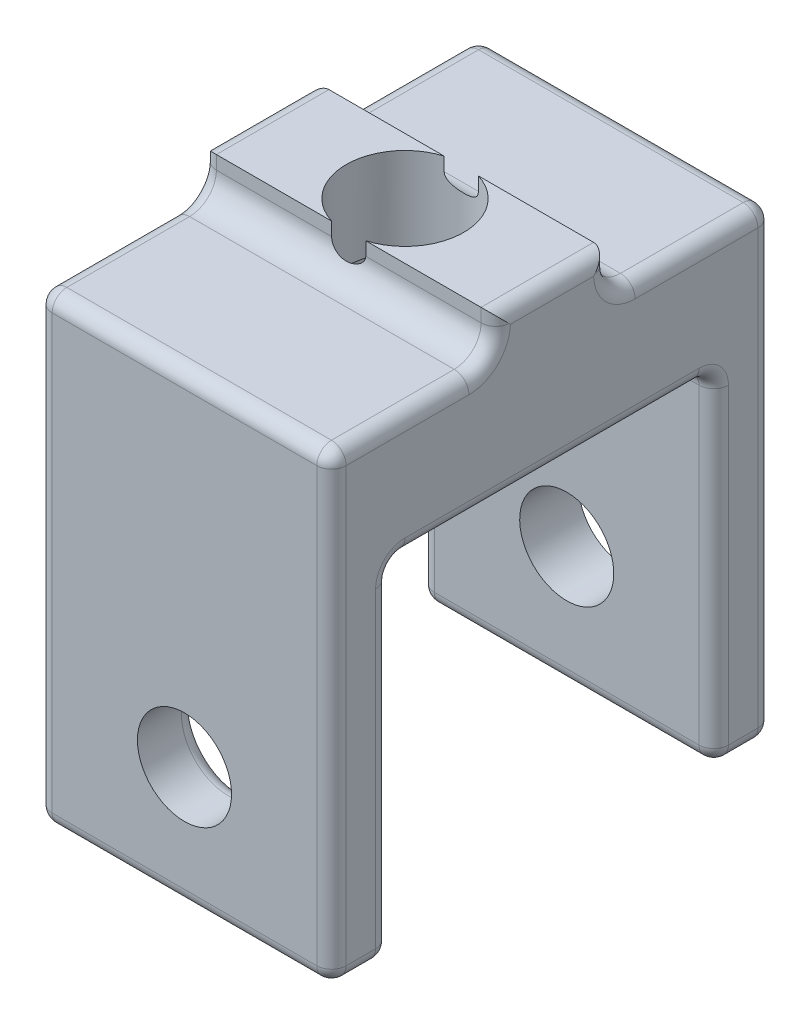
from build123d import *

# Parameters (mm, degrees)
SKETCH1_W           = 30
SKETCH1_H           = 8.25963266
BOSS_EXTRUDE1_DEPTH = 20
SKETCH2_R           = 4
CUT_EXTRUDE1_DEPTH  = 20
SKETCH2_3_R         = 8.5
SKETCH2_3_R_2       = 4
CUT_EXTRUDE2_DEPTH  = 5
SKETCH3_W           = 20
SKETCH3_H           = 23.2
SKETCH3_R           = 5
SKETCH3_R_2         = 3.2
BOSS_EXTRUDE2_DEPTH = 4
BOSS_EXTRUDE3_START = -26
SKETCH3_3_W         = 20
SKETCH3_3_H         = 23.2
SKETCH3_3_R         = 5
SKETCH3_3_R_2       = 3.2
BOSS_EXTRUDE3_DEPTH = 4
FILLET1_R           = 1


with BuildPart() as part:
    # Sketch1 → Boss-Extrude1 (new body)
    with BuildSketch(Plane(origin=(0, 0, 0), x_dir=(0, 0, -1), z_dir=(1, 0, 0))):
        with Locations((-10.691950058, -23.429816412)):
            Rectangle(SKETCH1_W, SKETCH1_H)
        with BuildLine():
            Line((-16.344503942, -19.300000082), (-5.039396175, -19.300000082))
            ThreePointArc((-5.039396175, -19.300000082), (-6.329725463, -18.765528762), (-6.864196994, -17.475199263))
            Line((-6.864196994, -17.475199263), (-6.864196994, -16.559632742))
            Line((-6.864196994, -16.559632742), (-14.519703122, -16.559632742))
            Line((-14.519703122, -16.559632742), (-14.519703122, -17.475199263))
            ThreePointArc((-14.519703122, -17.475199263), (-15.054174908, -18.765528296), (-16.344503942, -19.300000082))
        make_face()
    extrude(amount=BOSS_EXTRUDE1_DEPTH)

    # Sketch2 → Cut-Extrude1 (cut)
    with BuildSketch(Plane.XZ.offset(27.559632742)):
        with Locations(Location((10, 10.691950058, 0), (0, 0, 270))):
            Circle(SKETCH2_R)
    extrude(amount=-CUT_EXTRUDE1_DEPTH, mode=Mode.SUBTRACT)

    # Sketch2<3> → Cut-Extrude2 (cut)
    with BuildSketch(Plane.XZ.offset(27.559632742)):
        with Locations(Location((10, 10.691950058, 0), (0, 0, 270))):
            Circle(SKETCH2_3_R)
        with Locations(Location((10, 10.691950058, 0), (0, 0, 270))):
            Circle(SKETCH2_3_R_2, mode=Mode.SUBTRACT)
    extrude(amount=-CUT_EXTRUDE2_DEPTH, mode=Mode.SUBTRACT)

    # Sketch3 → Boss-Extrude2 (add)
    # profile 1 of 2: a face of its own
    with BuildSketch(Plane(origin=(0, 0, -4.308049942), x_dir=(-1, 0, 0), z_dir=(0, 0, -1))):
        with Locations((-10, -39.159632742)):
            Rectangle(SKETCH3_W, SKETCH3_H)
        with Locations((-10, -42.559632742)):
            Circle(SKETCH3_R, mode=Mode.SUBTRACT)
    # profile 2 of 2: a face of its own
    with BuildSketch(Plane(origin=(0, 0, -4.308049942), x_dir=(-1, 0, 0), z_dir=(0, 0, -1))):
        with Locations((-10, -42.559632742)):
            Circle(SKETCH3_R)
        with Locations(Location((-10, -42.559632742, 0), (0, 0, 90))):
            Circle(SKETCH3_R_2, mode=Mode.SUBTRACT)
    extrude(amount=-BOSS_EXTRUDE2_DEPTH)

    # Sketch3<3> → Boss-Extrude3 (add)
    # profile 1 of 2: a face of its own
    with BuildSketch(Plane(origin=(0, 0, -4.308049942), x_dir=(-1, 0, 0), z_dir=(0, 0, -1)).offset(BOSS_EXTRUDE3_START)):
        with Locations((-10, -39.159632742)):
            Rectangle(SKETCH3_3_W, SKETCH3_3_H)
        with Locations((-10, -42.559632742)):
            Circle(SKETCH3_3_R, mode=Mode.SUBTRACT)
    # profile 2 of 2: a face of its own
    with BuildSketch(Plane(origin=(0, 0, -4.308049942), x_dir=(-1, 0, 0), z_dir=(0, 0, -1)).offset(BOSS_EXTRUDE3_START)):
        with Locations((-10, -42.559632742)):
            Circle(SKETCH3_3_R)
        with Locations(Location((-10, -42.559632742, 0), (0, 0, 90))):
            Circle(SKETCH3_3_R_2, mode=Mode.SUBTRACT)
    extrude(amount=-BOSS_EXTRUDE3_DEPTH)

    # Fillet1
    # the kernel refuses this fillet: 1 mm, written as the material it adds along each edge
    with BuildSketch(Plane(origin=(20, -27.559632742, -0.308049942), x_dir=(0, 0, 1), z_dir=(-1, 0, 0)), Plane(origin=(20, -27.559632742, 21.691950058), x_dir=(0, -1, 0), z_dir=(-1, 0, 0))) as fillet1_piece_1:
        with BuildLine():
            CenterArc((FILLET1_R, -FILLET1_R), FILLET1_R, 90, 90)
            Line((0, -FILLET1_R), (0, 0))
            Line((0, 0), (FILLET1_R, 0))
        make_face()
    extrude(amount=20)
    # the kernel refuses this fillet: 1 mm, written as the material it takes off along each edge
    with BuildSketch(Plane(origin=(19, -20.300000082, -3.308049942), x_dir=(0, 0, -1), z_dir=(0, 1, 0))) as fillet1_2_piece_1_section:
        Polygon((0, 0), (FILLET1_R, 0), (FILLET1_R, -FILLET1_R), (0, -FILLET1_R), align=None)
    fillet1_2_piece_1 = extrude(amount=FILLET1_R, mode=Mode.PRIVATE)
    fillet1_2_piece_1 = fillet1_2_piece_1 - Plane(origin=(19, -20.300000082, -3.308049942), x_dir=(-0.7071067811865475, -2.5852550975749018e-14, 0.7071067811865475), z_dir=(0, 1, 0)) * Sphere(FILLET1_R, mode=Mode.PRIVATE)
    add(fillet1_2_piece_1, mode=Mode.SUBTRACT)
    with BuildSketch(Plane(origin=(19, -49.759632742, -3.308049942), x_dir=(0, 0, -1), z_dir=(0, -1, 0))) as fillet1_2_piece_2_section:
        Polygon((0, 0), (FILLET1_R, 0), (FILLET1_R, FILLET1_R), (0, FILLET1_R), align=None)
    fillet1_2_piece_2 = extrude(amount=FILLET1_R, mode=Mode.PRIVATE)
    fillet1_2_piece_2 = fillet1_2_piece_2 - Plane(origin=(19, -49.759632742, -3.308049942), x_dir=(-0.7071067811865475, -2.5852550975749018e-14, 0.7071067811865475), z_dir=(0, -1, 0)) * Sphere(FILLET1_R, mode=Mode.PRIVATE)
    add(fillet1_2_piece_2, mode=Mode.SUBTRACT)
    with BuildSketch(Plane(origin=(19, -20.300000082, 24.691950058), x_dir=(1, 0, 0), z_dir=(0, 1, 0))) as fillet1_2_piece_3_section:
        Polygon((0, 0), (FILLET1_R, 0), (FILLET1_R, -FILLET1_R), (0, -FILLET1_R), align=None)
    fillet1_2_piece_3 = extrude(amount=FILLET1_R, mode=Mode.PRIVATE)
    fillet1_2_piece_3 = fillet1_2_piece_3 - Plane(origin=(19, -20.300000082, 24.691950058), x_dir=(-0.7071067811865475, 2.5852550975749008e-14, -0.7071067811865475), z_dir=(0, 1, 0)) * Sphere(FILLET1_R, mode=Mode.PRIVATE)
    add(fillet1_2_piece_3, mode=Mode.SUBTRACT)
    with BuildSketch(Plane(origin=(19, -49.759632742, 24.691950058), x_dir=(0, 0, 1), z_dir=(1, 0, 0))) as fillet1_2_piece_4_section:
        Polygon((0, 0), (FILLET1_R, 0), (FILLET1_R, FILLET1_R), (0, FILLET1_R), align=None)
    fillet1_2_piece_4 = extrude(amount=FILLET1_R, mode=Mode.PRIVATE)
    fillet1_2_piece_4 = fillet1_2_piece_4 - Plane(origin=(19, -49.759632742, 24.691950058), x_dir=(0, 0.7071067811865733, -0.7071067811865216), z_dir=(1, 0, 0)) * Sphere(FILLET1_R, mode=Mode.PRIVATE)
    add(fillet1_2_piece_4, mode=Mode.SUBTRACT)
    with BuildSketch(Plane(origin=(1, -20.300000082, 24.691950058), x_dir=(-1, 0, 0), z_dir=(0, 1, 0))) as fillet1_2_piece_5_section:
        Polygon((0, 0), (FILLET1_R, 0), (FILLET1_R, FILLET1_R), (0, FILLET1_R), align=None)
    fillet1_2_piece_5 = extrude(amount=FILLET1_R, mode=Mode.PRIVATE)
    fillet1_2_piece_5 = fillet1_2_piece_5 - Plane(origin=(1, -20.300000082, 24.691950058), x_dir=(0.7071067811865475, 2.5852550975749008e-14, -0.7071067811865475), z_dir=(0, 1, 0)) * Sphere(FILLET1_R, mode=Mode.PRIVATE)
    add(fillet1_2_piece_5, mode=Mode.SUBTRACT)
    with BuildSketch(Plane(origin=(1, -49.759632742, 24.691950058), x_dir=(0, 0, 1), z_dir=(-1, 0, 0))) as fillet1_2_piece_6_section:
        Polygon((0, 0), (FILLET1_R, 0), (FILLET1_R, -FILLET1_R), (0, -FILLET1_R), align=None)
    fillet1_2_piece_6 = extrude(amount=FILLET1_R, mode=Mode.PRIVATE)
    fillet1_2_piece_6 = fillet1_2_piece_6 - Plane(origin=(1, -49.759632742, 24.691950058), x_dir=(0, 0.7071067811865733, -0.7071067811865216), z_dir=(-1, 0, 0)) * Sphere(FILLET1_R, mode=Mode.PRIVATE)
    add(fillet1_2_piece_6, mode=Mode.SUBTRACT)
    with BuildSketch(Plane(origin=(1, -49.759632742, -3.308049942), x_dir=(0, 0, -1), z_dir=(-1, 0, 0))) as fillet1_2_piece_7_section:
        Polygon((0, 0), (FILLET1_R, 0), (FILLET1_R, FILLET1_R), (0, FILLET1_R), align=None)
    fillet1_2_piece_7 = extrude(amount=FILLET1_R, mode=Mode.PRIVATE)
    fillet1_2_piece_7 = fillet1_2_piece_7 - Plane(origin=(1, -49.759632742, -3.308049942), x_dir=(0, 0.7071067811865216, 0.7071067811865733), z_dir=(-1, 0, 0)) * Sphere(FILLET1_R, mode=Mode.PRIVATE)
    add(fillet1_2_piece_7, mode=Mode.SUBTRACT)
    with BuildSketch(Plane(origin=(1, -20.300000082, -3.308049942), x_dir=(0, 0, -1), z_dir=(-1, 0, 0))) as fillet1_2_piece_8_section:
        Polygon((0, 0), (FILLET1_R, 0), (FILLET1_R, -FILLET1_R), (0, -FILLET1_R), align=None)
    fillet1_2_piece_8 = extrude(amount=FILLET1_R, mode=Mode.PRIVATE)
    fillet1_2_piece_8 = fillet1_2_piece_8 - Plane(origin=(1, -20.300000082, -3.308049942), x_dir=(0, -0.7071067811865605, 0.7071067811865346), z_dir=(-1, 0, 0)) * Sphere(FILLET1_R, mode=Mode.PRIVATE)
    add(fillet1_2_piece_8, mode=Mode.SUBTRACT)
    with BuildSketch(Plane(origin=(-2.5, -50.759632742, -0.308049942), x_dir=(0, 0, -1), z_dir=(1, 0, 0)), Plane(origin=(-2.5, -50.759632742, 21.691950058), x_dir=(0, 1, 0), z_dir=(1, 0, 0))) as fillet1_2_piece_9:
        with BuildLine():
            CenterArc((FILLET1_R, FILLET1_R), FILLET1_R, 180, 90)
            Line((0, FILLET1_R), (0, 0))
            Line((0, 0), (FILLET1_R, 0))
        make_face()
    extrude(amount=25, mode=Mode.SUBTRACT)
    with BuildSketch(Plane(origin=(20, -19.300000082, 5.039396175), x_dir=(0, -1, 0), z_dir=(0, 0, -1)), Plane(origin=(0, -19.300000082, 24.691950058), x_dir=(1, 0, 0), z_dir=(0, 0, -1))) as fillet1_2_piece_10:
        with BuildLine():
            CenterArc((FILLET1_R, FILLET1_R), FILLET1_R, 180, 90)
            Line((0, FILLET1_R), (0, 0))
            Line((0, 0), (FILLET1_R, 0))
        make_face()
    extrude(amount=8.347446117, mode=Mode.SUBTRACT)
    with BuildSketch(Plane(origin=(20, -49.759632742, -4.308049942), x_dir=(0, 0, 1), z_dir=(0, 1, 0)), Plane(origin=(20, -20.300000082, 25.691950058), x_dir=(0, 0, -1), z_dir=(0, -1, 0)), Plane(origin=(0, -49.759632742, 25.691950058), x_dir=(0, 0, -1), z_dir=(0, 1, 0)), Plane(origin=(0, -20.300000082, -4.308049942), x_dir=(0, 0, 1), z_dir=(0, -1, 0))) as fillet1_2_piece_11:
        with BuildLine():
            CenterArc((FILLET1_R, -FILLET1_R), FILLET1_R, 90, 90)
            Line((0, -FILLET1_R), (0, 0))
            Line((0, 0), (FILLET1_R, 0))
        make_face()
    extrude(amount=29.45963266, mode=Mode.SUBTRACT)
    with BuildSketch(Plane(origin=(20, -50.759632742, -3.308049942), x_dir=(0, 1, 0), z_dir=(0, 0, 1)), Plane(origin=(20, -50.759632742, 19.191950058), x_dir=(0, 1, 0), z_dir=(0, 0, 1))) as fillet1_2_piece_12:
        with BuildLine():
            CenterArc((FILLET1_R, FILLET1_R), FILLET1_R, 180, 90)
            Line((0, FILLET1_R), (0, 0))
            Line((0, 0), (FILLET1_R, 0))
        make_face()
    extrude(amount=5.5, mode=Mode.SUBTRACT)
    with BuildSketch(Plane(origin=(20, -19.300000082, 24.691950058), x_dir=(-1, 0, 0), z_dir=(0, 0, -1)), Plane(origin=(0, -19.300000082, 5.039396175), x_dir=(0, -1, 0), z_dir=(0, 0, -1))) as fillet1_2_piece_13:
        with BuildLine():
            CenterArc((FILLET1_R, -FILLET1_R), FILLET1_R, 90, 90)
            Line((0, -FILLET1_R), (0, 0))
            Line((0, 0), (FILLET1_R, 0))
        make_face()
    extrude(amount=8.347446117, mode=Mode.SUBTRACT)
    with BuildSketch(Plane(origin=(20, -17.475199263, 16.344503942), x_dir=(0, 0, -1), z_dir=(0, 1, 0))) as fillet1_2_piece_14:
        with BuildLine():
            CenterArc((1.824800819 + FILLET1_R, FILLET1_R), FILLET1_R, 180, 90)
            Line((1.824800819 + FILLET1_R, 0), (1.824800819, 0))
            Line((1.824800819, 0), (1.824800819, FILLET1_R))
        make_face()
    revolve(axis=Axis((20, -17.475199263, 16.344503942), (-1, 0, 0)), revolution_arc=90, mode=Mode.SUBTRACT)
    with BuildSketch(Plane(origin=(20, -16.559632742, 4.364196994), x_dir=(0, -1, 0), z_dir=(0, 0, 1))) as fillet1_2_piece_15:
        with BuildLine():
            CenterArc((FILLET1_R, -FILLET1_R), FILLET1_R, 90, 90)
            Line((0, -FILLET1_R), (0, 0))
            Line((0, 0), (FILLET1_R, 0))
        make_face()
    extrude(amount=12.655506128, mode=Mode.SUBTRACT)
    with BuildSketch(Plane(origin=(20, -17.475200493, 5.039397405), x_dir=(0, -0.9999999999997728, -6.741053946640154e-07), z_dir=(0, 6.741053946640154e-07, -0.9999999999997728))) as fillet1_2_piece_16:
        with BuildLine():
            CenterArc((1.824799589 + FILLET1_R, FILLET1_R), FILLET1_R, 180, 90)
            Line((1.824799589, FILLET1_R), (1.824799589, 0))
            Line((1.824799589, 0), (1.824799589 + FILLET1_R, 0))
        make_face()
    revolve(axis=Axis((20, -17.475200493, 5.039397405), (-1, 0, 0)), revolution_arc=90.000077247, mode=Mode.SUBTRACT)
    with BuildSketch(Plane(origin=(0, -16.559632742, 4.364196994), x_dir=(0, -1, 0), z_dir=(0, 0, 1))) as fillet1_2_piece_17:
        with BuildLine():
            CenterArc((FILLET1_R, FILLET1_R), FILLET1_R, 180, 90)
            Line((0, FILLET1_R), (0, 0))
            Line((0, 0), (FILLET1_R, 0))
        make_face()
    extrude(amount=12.655506128, mode=Mode.SUBTRACT)
    with BuildSketch(Plane(origin=(0, -17.475199263, 16.344503942), x_dir=(0, 0, -1), z_dir=(0, 1, 0))) as fillet1_2_piece_18:
        with BuildLine():
            CenterArc((1.824800819 + FILLET1_R, -FILLET1_R), FILLET1_R, 90, 90)
            Line((1.824800819, -FILLET1_R), (1.824800819, 0))
            Line((1.824800819, 0), (1.824800819 + FILLET1_R, 0))
        make_face()
    revolve(axis=Axis((0, -17.475199263, 16.344503942), (-1, 0, 0)), revolution_arc=90, mode=Mode.SUBTRACT)
    with BuildSketch(Plane(origin=(0, -50.759632742, -3.308049942), x_dir=(0, 1, 0), z_dir=(0, 0, 1)), Plane(origin=(0, -50.759632742, 19.191950058), x_dir=(0, 1, 0), z_dir=(0, 0, 1))) as fillet1_2_piece_19:
        with BuildLine():
            CenterArc((FILLET1_R, -FILLET1_R), FILLET1_R, 90, 90)
            Line((0, -FILLET1_R), (0, 0))
            Line((0, 0), (FILLET1_R, 0))
        make_face()
    extrude(amount=5.5, mode=Mode.SUBTRACT)
    with BuildSketch(Plane(origin=(0, -17.475200493, 5.039397405), x_dir=(0, -0.9999999999997728, -6.741053946640154e-07), z_dir=(0, 6.741053946640154e-07, -0.9999999999997728))) as fillet1_2_piece_20:
        with BuildLine():
            CenterArc((1.824799589 + FILLET1_R, -FILLET1_R), FILLET1_R, 90, 90)
            Line((1.824799589, -FILLET1_R), (1.824799589, 0))
            Line((1.824799589, 0), (1.824799589 + FILLET1_R, 0))
        make_face()
    revolve(axis=Axis((0, -17.475200493, 5.039397405), (-1, 0, 0)), revolution_arc=90.000077247, mode=Mode.SUBTRACT)
    with BuildSketch(Plane(origin=(1, -50.759632742, 25.691950058), x_dir=(0, 1.0, -2.3092638912203256e-12), z_dir=(1, 0, 0)), Plane(origin=(1, -19.300000082, 25.691950058), x_dir=(0, 0, -1), z_dir=(1, 0, 0))) as fillet1_2_piece_21:
        with BuildLine():
            CenterArc((FILLET1_R, -FILLET1_R), FILLET1_R, 90, 90)
            Line((0, -FILLET1_R), (0, 0))
            Line((0, 0), (FILLET1_R, 0))
        make_face()
    extrude(amount=18, mode=Mode.SUBTRACT)
    with BuildSketch(Plane(origin=(10, -42.559632742, 21.691950058), x_dir=(0, 1, 0), z_dir=(-1, 0, 0))) as fillet1_2_piece_22:
        with BuildLine():
            CenterArc((3.2 + FILLET1_R, -FILLET1_R), FILLET1_R, 90, 90)
            Line((3.2, -FILLET1_R), (3.2, 0))
            Line((3.2, 0), (3.2 + FILLET1_R, 0))
        make_face()
    revolve(axis=Axis((10, -42.559632742, 21.691950058), (0, 0, -1)), mode=Mode.SUBTRACT)
    with BuildSketch(Plane(origin=(1, -19.300000082, -4.308049942), x_dir=(0, 0, 1), z_dir=(1, 0, 0)), Plane(origin=(1, -50.759632742, -4.308049942), x_dir=(0, 1, 0), z_dir=(1, 0, 0))) as fillet1_2_piece_23:
        with BuildLine():
            CenterArc((FILLET1_R, FILLET1_R), FILLET1_R, 180, 90)
            Line((0, FILLET1_R), (0, 0))
            Line((0, 0), (FILLET1_R, 0))
        make_face()
    extrude(amount=18, mode=Mode.SUBTRACT)
    with BuildSketch(Plane(origin=(0, -17.475199263, 6.864196994), x_dir=(0, 0, 1), z_dir=(0, 1, 0)), Plane(origin=(0, -14.059632742, 14.519703122), x_dir=(0, 0, -1), z_dir=(0, -1, 0))) as fillet1_2_piece_24:
        with BuildLine():
            CenterArc((FILLET1_R, FILLET1_R), FILLET1_R, 180, 90)
            Line((0, FILLET1_R), (0, 0))
            Line((0, 0), (FILLET1_R, 0))
        make_face()
    extrude(amount=3.415566521, mode=Mode.SUBTRACT)
    with BuildSketch(Plane(origin=(20, -17.475199263, 6.864196994), x_dir=(0, 0, 1), z_dir=(0, 1, 0)), Plane(origin=(20, -14.059632742, 14.519703122), x_dir=(0, 0, -1), z_dir=(0, -1, 0))) as fillet1_2_piece_25:
        with BuildLine():
            CenterArc((FILLET1_R, -FILLET1_R), FILLET1_R, 90, 90)
            Line((0, -FILLET1_R), (0, 0))
            Line((0, 0), (FILLET1_R, 0))
        make_face()
    extrude(amount=3.415566521, mode=Mode.SUBTRACT)
    # the kernel refuses this fillet: 1 mm, written as the material it takes off along each edge
    with BuildSketch(Plane(origin=(1, -49.759632742, 22.691950058), x_dir=(0, 0, -1), z_dir=(-1, 0, 0))) as fillet1_3_piece_1_section:
        Polygon((0, 0), (FILLET1_R, 0), (FILLET1_R, FILLET1_R), (0, FILLET1_R), align=None)
    fillet1_3_piece_1 = extrude(amount=FILLET1_R, mode=Mode.PRIVATE)
    fillet1_3_piece_1 = fillet1_3_piece_1 - Plane(origin=(1, -49.759632742, 22.691950058), x_dir=(0, 0.7071067811865216, 0.7071067811865733), z_dir=(-1, 0, 0)) * Sphere(FILLET1_R, mode=Mode.PRIVATE)
    add(fillet1_3_piece_1, mode=Mode.SUBTRACT)
    with BuildSketch(Plane(origin=(19, -49.759632742, 22.691950058), x_dir=(0, 0, -1), z_dir=(1, 0, 0))) as fillet1_3_piece_2_section:
        Polygon((0, 0), (FILLET1_R, 0), (FILLET1_R, -FILLET1_R), (0, -FILLET1_R), align=None)
    fillet1_3_piece_2 = extrude(amount=FILLET1_R, mode=Mode.PRIVATE)
    fillet1_3_piece_2 = fillet1_3_piece_2 - Plane(origin=(19, -49.759632742, 22.691950058), x_dir=(0, 0.7071067811865216, 0.7071067811865733), z_dir=(1, 0, 0)) * Sphere(FILLET1_R, mode=Mode.PRIVATE)
    add(fillet1_3_piece_2, mode=Mode.SUBTRACT)
    with BuildSketch(Plane(origin=(1, -49.759632742, -1.308049942), x_dir=(0, 0, 1), z_dir=(-1, 0, 0))) as fillet1_3_piece_3_section:
        Polygon((0, 0), (FILLET1_R, 0), (FILLET1_R, -FILLET1_R), (0, -FILLET1_R), align=None)
    fillet1_3_piece_3 = extrude(amount=FILLET1_R, mode=Mode.PRIVATE)
    fillet1_3_piece_3 = fillet1_3_piece_3 - Plane(origin=(1, -49.759632742, -1.308049942), x_dir=(0, 0.7071067811865733, -0.7071067811865216), z_dir=(-1, 0, 0)) * Sphere(FILLET1_R, mode=Mode.PRIVATE)
    add(fillet1_3_piece_3, mode=Mode.SUBTRACT)
    with BuildSketch(Plane(origin=(19, -49.759632742, -1.308049942), x_dir=(0, 0, 1), z_dir=(1, 0, 0))) as fillet1_3_piece_4_section:
        Polygon((0, 0), (FILLET1_R, 0), (FILLET1_R, FILLET1_R), (0, FILLET1_R), align=None)
    fillet1_3_piece_4 = extrude(amount=FILLET1_R, mode=Mode.PRIVATE)
    fillet1_3_piece_4 = fillet1_3_piece_4 - Plane(origin=(19, -49.759632742, -1.308049942), x_dir=(0, 0.7071067811865733, -0.7071067811865216), z_dir=(1, 0, 0)) * Sphere(FILLET1_R, mode=Mode.PRIVATE)
    add(fillet1_3_piece_4, mode=Mode.SUBTRACT)
    with BuildSketch(Plane(origin=(20, -49.759632742, -0.308049942), x_dir=(0, 0, -1), z_dir=(0, 1, 0)), Plane(origin=(0, -28.559632742, -0.308049942), x_dir=(0, 0, -1), z_dir=(0, -1, 0))) as fillet1_3_piece_5:
        with BuildLine():
            CenterArc((FILLET1_R, FILLET1_R), FILLET1_R, 180, 90)
            Line((0, FILLET1_R), (0, 0))
            Line((0, 0), (FILLET1_R, 0))
        make_face()
    extrude(amount=21.2, mode=Mode.SUBTRACT)
    with BuildSketch(Plane(origin=(20, -27.559632742, 0.691950058), x_dir=(0, 1, 0), z_dir=(0, 0, 1))) as fillet1_3_piece_6:
        with BuildLine():
            CenterArc((FILLET1_R, FILLET1_R), FILLET1_R, 180, 90)
            Line((0, FILLET1_R), (0, 0))
            Line((0, 0), (FILLET1_R, 0))
        make_face()
    extrude(amount=20, mode=Mode.SUBTRACT)
    with BuildSketch(Plane(origin=(0, -27.559632742, 0.691950058), x_dir=(0, 1, 0), z_dir=(0, 0, 1))) as fillet1_3_piece_7:
        with BuildLine():
            CenterArc((FILLET1_R, -FILLET1_R), FILLET1_R, 90, 90)
            Line((0, -FILLET1_R), (0, 0))
            Line((0, 0), (FILLET1_R, 0))
        make_face()
    extrude(amount=20, mode=Mode.SUBTRACT)
    with BuildSketch(Plane(origin=(20, -49.759632742, 21.691950058), x_dir=(0, 0, 1), z_dir=(0, 1, 0)), Plane(origin=(0, -28.559632742, 21.691950058), x_dir=(0, 0, 1), z_dir=(0, -1, 0))) as fillet1_3_piece_8:
        with BuildLine():
            CenterArc((FILLET1_R, -FILLET1_R), FILLET1_R, 90, 90)
            Line((0, -FILLET1_R), (0, 0))
            Line((0, 0), (FILLET1_R, 0))
        make_face()
    extrude(amount=21.2, mode=Mode.SUBTRACT)
    with BuildSketch(Plane(origin=(0, -28.559632742, 20.691950058), x_dir=(0, 0, 1), z_dir=(0, -1, 0))) as fillet1_3_piece_9:
        with BuildLine():
            CenterArc((1 + FILLET1_R, -FILLET1_R), FILLET1_R, 90, 90)
            Line((1, -FILLET1_R), (1, 0))
            Line((1, 0), (1 + FILLET1_R, 0))
        make_face()
    revolve(axis=Axis((0, -28.559632742, 20.691950058), (-1, 0, 0)), revolution_arc=90, mode=Mode.SUBTRACT)
    with BuildSketch(Plane(origin=(20, -28.559632742, 20.691950058), x_dir=(0, 0, 1), z_dir=(0, -1, 0))) as fillet1_3_piece_10:
        with BuildLine():
            CenterArc((1 + FILLET1_R, FILLET1_R), FILLET1_R, 180, 90)
            Line((1, FILLET1_R), (1, 0))
            Line((1, 0), (1 + FILLET1_R, 0))
        make_face()
    revolve(axis=Axis((20, -28.559632742, 20.691950058), (-1, 0, 0)), revolution_arc=90, mode=Mode.SUBTRACT)
    with BuildSketch(Plane(origin=(0, -28.559632742, 0.691950058), x_dir=(0, 1, 0), z_dir=(0, 0, 1))) as fillet1_3_piece_11:
        with BuildLine():
            CenterArc((1 + FILLET1_R, -FILLET1_R), FILLET1_R, 90, 90)
            Line((1, -FILLET1_R), (1, 0))
            Line((1, 0), (1 + FILLET1_R, 0))
        make_face()
    revolve(axis=Axis((0, -28.559632742, 0.691950058), (-1, 0, 0)), revolution_arc=90, mode=Mode.SUBTRACT)
    with BuildSketch(Plane(origin=(20, -28.559632742, 0.691950058), x_dir=(0, 1, 0), z_dir=(0, 0, 1))) as fillet1_3_piece_12:
        with BuildLine():
            CenterArc((1 + FILLET1_R, FILLET1_R), FILLET1_R, 180, 90)
            Line((1, FILLET1_R), (1, 0))
            Line((1, 0), (1 + FILLET1_R, 0))
        make_face()
    revolve(axis=Axis((20, -28.559632742, 0.691950058), (-1, 0, 0)), revolution_arc=90, mode=Mode.SUBTRACT)


solid = part.part
